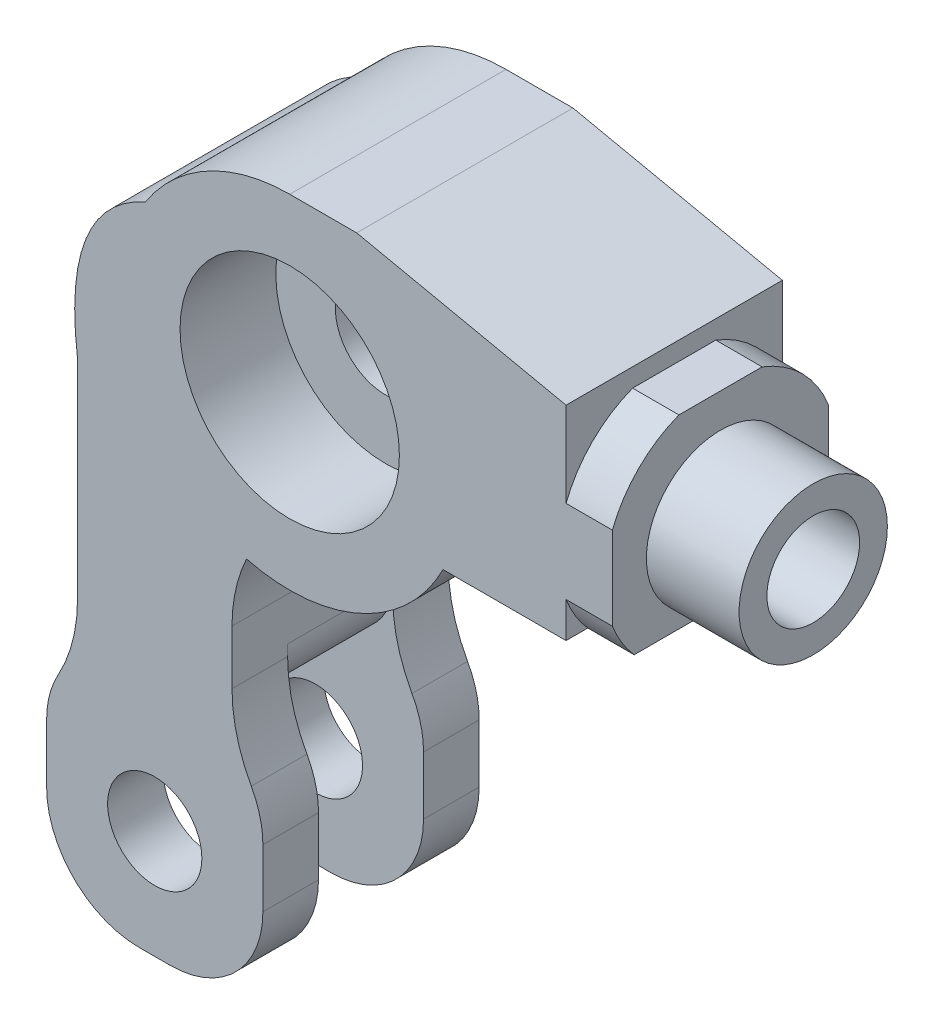
from build123d import *

# Parameters (mm, degrees)
SKETCH1_R           = 1.625
SKETCH1_R_2         = 1.525
BOSS_EXTRUDE1_DEPTH = 7
SKETCH2_R           = 1.5
CUT_EXTRUDE1_DEPTH  = 3
SKETCH3_W           = 10.588435917
SKETCH3_H           = 3.4
CUT_EXTRUDE2_DEPTH  = 6.11
FILLET1_R           = 5
BOSS_EXTRUDE2_DEPTH = 7
BOSS_EXTRUDE3_DEPTH = 1.8
BOSS_EXTRUDE4_START = -7
BOSS_EXTRUDE4_DEPTH = 1.8
FILLET4_R           = 5
FILLET5_R           = 3
FILLET6_R           = 2
CUT_EXTRUDE3_START  = -3
SKETCH8_W           = 5.7
SKETCH8_H           = 8.259283933
CUT_EXTRUDE3_DEPTH  = 2.6
FILLET7_R           = 0.7
SKETCH9_R           = 5.326360015
SKETCH9_R_2         = 3.75
CUT_EXTRUDE5_DEPTH  = 2.5
SKETCH10_R          = 4.869989517
SKETCH10_R_2        = 2.4
CUT_EXTRUDE6_DEPTH  = 1
BOSS_EXTRUDE5_START = 2
SKETCH11_R          = 2.4
SKETCH11_R_2        = 1.5
BOSS_EXTRUDE5_DEPTH = 2
CUT_EXTRUDE7_START  = -7
SKETCH12_R          = 3.575
CUT_EXTRUDE7_DEPTH  = 3.1
CUT_EXTRUDE8_START  = -3.1
SKETCH14_R          = 3.575
CUT_EXTRUDE8_DEPTH  = 3.1
SKETCH15_R          = 5.55
SKETCH15_R_2        = 3.55
BOSS_EXTRUDE6_DEPTH = 7
SKETCH16_R          = 1.407083064
BOSS_EXTRUDE7_DEPTH = 1
SKETCH17_R          = 1.5
CUT_EXTRUDE9_DEPTH  = 2.2
BOSS_EXTRUDE8_DEPTH = 7
CUT_EXTRUDE10_START = -3.1
SKETCH19_R          = 3.55
CUT_EXTRUDE10_DEPTH = 3.1


with BuildPart() as part:
    # Sketch1 → Boss-Extrude1 (new body)
    with BuildSketch(Plane.XY):
        Polygon((2.722541385, 17.747241978), (-15.590111015, 17.747241978), (-15.590111015, -1.762758022), (-10.590111015, -1.762758022), (-10.590111015, 9.80448846), (-10.590111015, 12.747241978), (2.722541385, 12.747241978), align=None)
        with Locations((-8.721930535, 15.237241978)):
            Circle(SKETCH1_R, mode=Mode.SUBTRACT)
        with Locations((-13.090111015, 0.749566092)):
            Circle(SKETCH1_R_2, mode=Mode.SUBTRACT)
    extrude(amount=BOSS_EXTRUDE1_DEPTH)

    # Sketch2 → Cut-Extrude1 (cut)
    with BuildSketch(Plane(origin=(2.722541385, 0, 0), x_dir=(0, 0, -1), z_dir=(1, 0, 0))):
        with Locations(Location((-3.5, 15.247241978, 0), (0, 0, 90))):
            Circle(SKETCH2_R)
    extrude(amount=-CUT_EXTRUDE1_DEPTH, mode=Mode.SUBTRACT)

    # Sketch3 → Cut-Extrude2 (cut)
    with BuildSketch(Plane.XZ.offset(1.762758022)):
        with Locations((-13.988004801, 3.5)):
            Rectangle(SKETCH3_W, SKETCH3_H)
    extrude(amount=-CUT_EXTRUDE2_DEPTH, mode=Mode.SUBTRACT)

    # Fillet1
    fillet1_edges = [part.edges().sort_by_distance(p)[0] for p in [
        (-10.590111015, 12.747241978, 3.5),
        (-15.590111015, 17.747241978, 3.5),
    ]]
    fillet(fillet1_edges, radius=FILLET1_R)

    # Sketch5 → Boss-Extrude2 (add)
    with BuildSketch(Plane.XY.offset(7)):
        with BuildLine():
            Line((2.722541385, 17.747241978), (-10.590111015, 17.747241978))
            Line((-10.590111015, 17.747241978), (-15.590111015, 12.747241978))
            add(Edge.make_bspline(
                [(-10.590111015, 18.747241978), (-16.362035667, 18.743656789), (-15.590111015, 12.747241978)],
                knots=[0, 0, 0, 1, 1, 1], degree=2))
            Line((-10.590111015, 18.747241978), (2.722541385, 18.747241978))
            Line((2.722541385, 18.747241978), (2.722541385, 17.747241978))
        make_face()
    extrude(amount=-BOSS_EXTRUDE2_DEPTH)

    # Sketch7 → Boss-Extrude3 (add)
    with BuildSketch(Plane.XY.offset(7)):
        Polygon((-10.590111015, -1.762758022), (-10.590111015, 2.992241978), (-9.590111015, 2.992241978), (-9.590111015, -1.762758022), (-9.590111015, -2.762758022), (-16.590111015, -2.762758022), (-16.590111015, -1.762758022), (-16.590111015, 2.992241978), (-15.590111015, 2.992241978), (-15.590111015, -1.762758022), align=None)
    extrude(amount=-BOSS_EXTRUDE3_DEPTH)

    # Sketch7<2> → Boss-Extrude4 (add)
    with BuildSketch(Plane.XY.offset(7).offset(BOSS_EXTRUDE4_START)):
        Polygon((-10.590111015, -1.762758022), (-10.590111015, 2.992241978), (-9.590111015, 2.992241978), (-9.590111015, -1.762758022), (-9.590111015, -2.762758022), (-16.590111015, -2.762758022), (-16.590111015, -1.762758022), (-16.590111015, 2.992241978), (-15.590111015, 2.992241978), (-15.590111015, -1.762758022), align=None)
    extrude(amount=BOSS_EXTRUDE4_DEPTH)

    # Fillet4
    # the kernel refuses this fillet: 5 mm, written as the material it adds along each edge
    with BuildSketch(Plane(origin=(-15.590111015, 2.992241978, 0), x_dir=(0, 1, 0), z_dir=(0, 0, 1))) as fillet4_piece_1_section:
        with BuildLine():
            CenterArc((3, 5), FILLET4_R, 233.130102354, 36.869897646)
            Line((0, 1), (-0.06, 0.92))
            ThreePointArc((-0.06, 0.92), (-0.1, 0.5), (-0.1, 0))
            Line((-0.1, 0), (0, -0.1))
            Line((0, -0.1), (3, -0.1))
            Line((3, -0.1), (3, 0))
        make_face()
    fillet4_piece_1 = extrude(amount=1.8, mode=Mode.PRIVATE)
    fillet4_piece_1 = split(fillet4_piece_1, bisect_by=Plane(origin=(-15.603784391, 4.347241978, 0.9), z_dir=(0, 1, 0)), keep=Keep.TOP, mode=Mode.PRIVATE)
    add(fillet4_piece_1)
    with BuildSketch(Plane(origin=(-15.590111015, 2.992241978, 0), x_dir=(0, 1, 0), z_dir=(0, 0, 1))) as fillet4_piece_2_section:
        with BuildLine():
            CenterArc((3, 5), FILLET4_R, 233.130102354, 36.869897646)
            Line((0, 1), (-0.06, 0.92))
            ThreePointArc((-0.06, 0.92), (-0.1, 0.5), (-0.1, 0))
            Line((-0.1, 0), (0, -0.1))
            Line((0, -0.1), (3, -0.1))
            Line((3, -0.1), (3, 0))
        make_face()
    fillet4_piece_2 = extrude(amount=1.8, mode=Mode.PRIVATE)
    fillet4_piece_2 = split(fillet4_piece_2, bisect_by=Plane(origin=(-15.881039753, 4.347241978, 0.9), z_dir=(0, -1, 0)), keep=Keep.TOP, mode=Mode.PRIVATE)
    add(fillet4_piece_2)
    with BuildSketch(Plane(origin=(-15.590111015, 2.992241978, 0), x_dir=(0, 1, 0), z_dir=(0, 0, 1))) as fillet4_piece_3_section:
        with BuildLine():
            CenterArc((3, 5), FILLET4_R, 233.130102354, 36.869897646)
            Line((0, 1), (-0.06, 0.92))
            ThreePointArc((-0.06, 0.92), (-0.1, 0.5), (-0.1, 0))
            Line((-0.1, 0), (0, -0.1))
            Line((0, -0.1), (3, -0.1))
            Line((3, -0.1), (3, 0))
        make_face()
    fillet4_piece_3 = extrude(amount=9.3, mode=Mode.PRIVATE)
    fillet4_piece_3 = split(fillet4_piece_3, bisect_by=Plane(origin=(-15.603784391, 4.971879793, 1.8), z_dir=(0, 0, 1)), keep=Keep.TOP, mode=Mode.PRIVATE)
    fillet4_piece_3 = split(fillet4_piece_3, bisect_by=Plane(origin=(-15.603784391, 4.347241978, 3.5), z_dir=(0, 1, 0)), keep=Keep.TOP, mode=Mode.PRIVATE)
    fillet4_piece_3 = split(fillet4_piece_3, bisect_by=Plane(origin=(-15.603784391, 4.971879793, 5.2), z_dir=(0, 0, -1)), keep=Keep.TOP, mode=Mode.PRIVATE)
    add(fillet4_piece_3)
    with BuildSketch(Plane(origin=(-15.590111015, 2.992241978, 0), x_dir=(0, 1, 0), z_dir=(0, 0, 1))) as fillet4_piece_4_section:
        with BuildLine():
            CenterArc((3, 5), FILLET4_R, 233.130102354, 36.869897646)
            Line((0, 1), (-0.06, 0.92))
            ThreePointArc((-0.06, 0.92), (-0.1, 0.5), (-0.1, 0))
            Line((-0.1, 0), (0, -0.1))
            Line((0, -0.1), (3, -0.1))
            Line((3, -0.1), (3, 0))
        make_face()
    fillet4_piece_4 = extrude(amount=9.3, mode=Mode.PRIVATE)
    fillet4_piece_4 = split(fillet4_piece_4, bisect_by=Plane(origin=(-15.603784391, 4.347241978, 6.1), z_dir=(0, 1, 0)), keep=Keep.TOP, mode=Mode.PRIVATE)
    fillet4_piece_4 = split(fillet4_piece_4, bisect_by=Plane(origin=(-15.603784391, 4.971879793, 5.2), z_dir=(0, 0, 1)), keep=Keep.TOP, mode=Mode.PRIVATE)
    fillet4_piece_4 = split(fillet4_piece_4, bisect_by=Plane(origin=(-15.603784391, 4.971879793, 7), z_dir=(0, 0, -1)), keep=Keep.TOP, mode=Mode.PRIVATE)
    add(fillet4_piece_4)
    with BuildSketch(Plane(origin=(-15.590111015, 2.992241978, 0), x_dir=(0, 1, 0), z_dir=(0, 0, 1))) as fillet4_piece_5_section:
        with BuildLine():
            CenterArc((3, 5), FILLET4_R, 233.130102354, 36.869897646)
            Line((0, 1), (-0.06, 0.92))
            ThreePointArc((-0.06, 0.92), (-0.1, 0.5), (-0.1, 0))
            Line((-0.1, 0), (0, -0.1))
            Line((0, -0.1), (3, -0.1))
            Line((3, -0.1), (3, 0))
        make_face()
    fillet4_piece_5 = extrude(amount=9.3, mode=Mode.PRIVATE)
    fillet4_piece_5 = split(fillet4_piece_5, bisect_by=Plane(origin=(-15.881039753, 4.347241978, 6.1), z_dir=(0, -1, 0)), keep=Keep.TOP, mode=Mode.PRIVATE)
    fillet4_piece_5 = split(fillet4_piece_5, bisect_by=Plane(origin=(-15.881039753, 3.497683508, 5.2), z_dir=(0, 0, 1)), keep=Keep.TOP, mode=Mode.PRIVATE)
    fillet4_piece_5 = split(fillet4_piece_5, bisect_by=Plane(origin=(-15.881039753, 3.497683508, 7), z_dir=(0, 0, -1)), keep=Keep.TOP, mode=Mode.PRIVATE)
    add(fillet4_piece_5)
    with BuildSketch(Plane(origin=(-10.590111015, 2.992241978, 0), x_dir=(0, 1, 0), z_dir=(0, 0, 1))) as fillet4_piece_6_section:
        with BuildLine():
            CenterArc((3, -5), FILLET4_R, 90, 36.869897646)
            Line((0, -1), (-0.06, -0.92))
            ThreePointArc((-0.06, -0.92), (-0.1, -0.5), (-0.1, 0))
            Line((-0.1, 0), (0, 0.1))
            Line((0, 0.1), (3, 0.1))
            Line((3, 0.1), (3, 0))
        make_face()
    fillet4_piece_6 = extrude(amount=1.8, mode=Mode.PRIVATE)
    fillet4_piece_6 = split(fillet4_piece_6, bisect_by=Plane(origin=(-10.576437639, 4.347241978, 0.9), z_dir=(0, 1, 0)), keep=Keep.TOP, mode=Mode.PRIVATE)
    add(fillet4_piece_6)
    with BuildSketch(Plane(origin=(-10.590111015, 2.992241978, 0), x_dir=(0, 1, 0), z_dir=(0, 0, 1))) as fillet4_piece_7_section:
        with BuildLine():
            CenterArc((3, -5), FILLET4_R, 90, 36.869897646)
            Line((0, -1), (-0.06, -0.92))
            ThreePointArc((-0.06, -0.92), (-0.1, -0.5), (-0.1, 0))
            Line((-0.1, 0), (0, 0.1))
            Line((0, 0.1), (3, 0.1))
            Line((3, 0.1), (3, 0))
        make_face()
    fillet4_piece_7 = extrude(amount=1.8, mode=Mode.PRIVATE)
    fillet4_piece_7 = split(fillet4_piece_7, bisect_by=Plane(origin=(-10.299182277, 4.347241978, 0.9), z_dir=(0, -1, 0)), keep=Keep.TOP, mode=Mode.PRIVATE)
    add(fillet4_piece_7)
    with BuildSketch(Plane(origin=(-10.590111015, 2.992241978, 0), x_dir=(0, 1, 0), z_dir=(0, 0, 1))) as fillet4_piece_8_section:
        with BuildLine():
            CenterArc((3, -5), FILLET4_R, 90, 36.869897646)
            Line((0, -1), (-0.06, -0.92))
            ThreePointArc((-0.06, -0.92), (-0.1, -0.5), (-0.1, 0))
            Line((-0.1, 0), (0, 0.1))
            Line((0, 0.1), (3, 0.1))
            Line((3, 0.1), (3, 0))
        make_face()
    fillet4_piece_8 = extrude(amount=9.3, mode=Mode.PRIVATE)
    fillet4_piece_8 = split(fillet4_piece_8, bisect_by=Plane(origin=(-10.576437639, 4.971879793, 5.2), z_dir=(0, 0, -1)), keep=Keep.TOP, mode=Mode.PRIVATE)
    fillet4_piece_8 = split(fillet4_piece_8, bisect_by=Plane(origin=(-10.576437639, 4.347241978, 3.5), z_dir=(0, 1, 0)), keep=Keep.TOP, mode=Mode.PRIVATE)
    fillet4_piece_8 = split(fillet4_piece_8, bisect_by=Plane(origin=(-10.576437639, 4.971879793, 1.8), z_dir=(0, 0, 1)), keep=Keep.TOP, mode=Mode.PRIVATE)
    add(fillet4_piece_8)
    with BuildSketch(Plane(origin=(-10.590111015, 2.992241978, 0), x_dir=(0, 1, 0), z_dir=(0, 0, 1))) as fillet4_piece_9_section:
        with BuildLine():
            CenterArc((3, -5), FILLET4_R, 90, 36.869897646)
            Line((0, -1), (-0.06, -0.92))
            ThreePointArc((-0.06, -0.92), (-0.1, -0.5), (-0.1, 0))
            Line((-0.1, 0), (0, 0.1))
            Line((0, 0.1), (3, 0.1))
            Line((3, 0.1), (3, 0))
        make_face()
    fillet4_piece_9 = extrude(amount=9.3, mode=Mode.PRIVATE)
    fillet4_piece_9 = split(fillet4_piece_9, bisect_by=Plane(origin=(-10.576437639, 4.971879793, 7), z_dir=(0, 0, -1)), keep=Keep.TOP, mode=Mode.PRIVATE)
    fillet4_piece_9 = split(fillet4_piece_9, bisect_by=Plane(origin=(-10.576437639, 4.971879793, 5.2), z_dir=(0, 0, 1)), keep=Keep.TOP, mode=Mode.PRIVATE)
    fillet4_piece_9 = split(fillet4_piece_9, bisect_by=Plane(origin=(-10.576437639, 4.347241978, 6.1), z_dir=(0, 1, 0)), keep=Keep.TOP, mode=Mode.PRIVATE)
    add(fillet4_piece_9)
    with BuildSketch(Plane(origin=(-10.590111015, 2.992241978, 0), x_dir=(0, 1, 0), z_dir=(0, 0, 1))) as fillet4_piece_10_section:
        with BuildLine():
            CenterArc((3, -5), FILLET4_R, 90, 36.869897646)
            Line((0, -1), (-0.06, -0.92))
            ThreePointArc((-0.06, -0.92), (-0.1, -0.5), (-0.1, 0))
            Line((-0.1, 0), (0, 0.1))
            Line((0, 0.1), (3, 0.1))
            Line((3, 0.1), (3, 0))
        make_face()
    fillet4_piece_10 = extrude(amount=9.3, mode=Mode.PRIVATE)
    fillet4_piece_10 = split(fillet4_piece_10, bisect_by=Plane(origin=(-10.299182277, 3.497683508, 7), z_dir=(0, 0, -1)), keep=Keep.TOP, mode=Mode.PRIVATE)
    fillet4_piece_10 = split(fillet4_piece_10, bisect_by=Plane(origin=(-10.299182277, 3.497683508, 5.2), z_dir=(0, 0, 1)), keep=Keep.TOP, mode=Mode.PRIVATE)
    fillet4_piece_10 = split(fillet4_piece_10, bisect_by=Plane(origin=(-10.299182277, 4.347241978, 6.1), z_dir=(0, -1, 0)), keep=Keep.TOP, mode=Mode.PRIVATE)
    add(fillet4_piece_10)

    # Fillet5
    fillet5_edges = [part.edges().sort_by_distance(p)[0] for p in [
        (-9.590111015, 2.992241978, 6.1),
        (-9.590111015, -2.762758022, 6.1),
        (-16.590111015, -2.762758022, 6.1),
        (-16.590111015, 2.992241978, 6.1),
        (-9.590111015, 2.992241978, 0.9),
        (-9.590111015, -2.762758022, 0.9),
        (-16.590111015, -2.762758022, 0.9),
        (-16.590111015, 2.992241978, 0.9),
    ]]
    fillet(fillet5_edges, radius=FILLET5_R)

    # Fillet6
    # the kernel refuses this fillet: 2 mm, written as the material it takes off along each edge
    with BuildSketch(Plane(origin=(-15.868461409, 4.347241978, 1.8), x_dir=(1, 0, 0), z_dir=(0, 0, 1))) as fillet6_piece_1:
        with BuildLine():
            CenterArc((2.278350394, 2), FILLET6_R, 180, 90)
            Line((0.278350394, 2), (0.078350394, 2))
            ThreePointArc((0.078350394, 2), (0.078350394, 1.645), (-0.188865984, 0.0658))
            Line((-0.188865984, 0.0658), (0, -0.2))
            Line((0, -0.2), (2.278350394, -0.2))
            Line((2.278350394, -0.2), (2.278350394, 0))
        make_face()
    extrude(amount=3.4, mode=Mode.SUBTRACT)
    with BuildSketch(Plane(origin=(-10.311760621, 4.347241978, 5.2), x_dir=(-0.13784657416957666, 0.9904535940616861, 0), z_dir=(0, 0, -1))) as fillet6_piece_2:
        with BuildLine():
            CenterArc((2.294969985, -1.980907188), FILLET6_R, 97.923255875, 90)
            Line((0.314062797, -2.256600336), (0.115972078, -2.284169651))
            Line((0.115972078, -2.284169651), (-0.198090719, -0.027569315))
            Line((-0.198090719, -0.027569315), (0.039137318, 0.196133297))
            ThreePointArc((0.039137318, 0.196133297), (1.640096496, 0.149155185), (1.991707522, 0.198090719))
            Line((1.991707522, 0.198090719), (2.019276836, 0))
        make_face()
    extrude(amount=3.4, mode=Mode.SUBTRACT)

    # Sketch8 → Cut-Extrude3 (cut)
    with BuildSketch(Plane(origin=(2.722541385, 0, 0), x_dir=(0, 0, -1), z_dir=(1, 0, 0)).offset(CUT_EXTRUDE3_START)):
        with Locations((-3.5, 15.247241978)):
            Rectangle(SKETCH8_W, SKETCH8_H)
    extrude(amount=-CUT_EXTRUDE3_DEPTH, mode=Mode.SUBTRACT)

    # Fillet7
    # the kernel refuses this fillet: 0.7 mm, written as the material it takes off along each edge
    with BuildSketch(Plane(origin=(-0.277458615, 12.747241978, 0.65), x_dir=(0, 0, -1), z_dir=(-1, 0, 0)), Plane(origin=(-2.877458615, 12.747241978, 6.35), x_dir=(0, 0, 1), z_dir=(1, 0, 0))) as fillet7_piece_1:
        with BuildLine():
            CenterArc((FILLET7_R, -FILLET7_R), FILLET7_R, 90, 90)
            Line((0, -FILLET7_R), (0, 0))
            Line((0, 0), (FILLET7_R, 0))
        make_face()
    extrude(amount=2.6, mode=Mode.SUBTRACT)

    # Sketch9 → Cut-Extrude5 (cut)
    with BuildSketch(Plane(origin=(2.722541385, 0, 0), x_dir=(0, 0, -1), z_dir=(1, 0, 0))):
        with Locations((-3.5, 15.247241978)):
            Circle(SKETCH9_R)
        with Locations((-3.5, 15.247241978)):
            Circle(SKETCH9_R_2, mode=Mode.SUBTRACT)
    extrude(amount=-CUT_EXTRUDE5_DEPTH, mode=Mode.SUBTRACT)

    # Sketch10 → Cut-Extrude6 (cut)
    with BuildSketch(Plane(origin=(2.722541385, 0, 0), x_dir=(0, 0, -1), z_dir=(1, 0, 0))):
        with Locations((-3.5, 15.247241978)):
            Circle(SKETCH10_R)
        with Locations((-3.5, 15.247241978)):
            Circle(SKETCH10_R_2, mode=Mode.SUBTRACT)
    extrude(amount=-CUT_EXTRUDE6_DEPTH, mode=Mode.SUBTRACT)

    # Sketch11 → Boss-Extrude5 (add)
    with BuildSketch(Plane(origin=(2.722541385, 0, 0), x_dir=(0, 0, -1), z_dir=(1, 0, 0)).offset(BOSS_EXTRUDE5_START)):
        with Locations((-3.5, 15.247241978)):
            Circle(SKETCH11_R)
        with Locations(Location((-3.5, 15.247241978, 0), (0, 0, 90))):
            Circle(SKETCH11_R_2, mode=Mode.SUBTRACT)
    extrude(amount=-BOSS_EXTRUDE5_DEPTH)

    # Sketch12 → Cut-Extrude7 (cut)
    with BuildSketch(Plane.XY.offset(7).offset(CUT_EXTRUDE7_START)):
        with Locations((-8.721930535, 15.237241978)):
            Circle(SKETCH12_R)
    extrude(amount=CUT_EXTRUDE7_DEPTH, mode=Mode.SUBTRACT)

    # Sketch14 → Cut-Extrude8 (cut)
    with BuildSketch(Plane.XY.offset(7).offset(CUT_EXTRUDE8_START)):
        with Locations((-8.721930535, 15.237241978)):
            Circle(SKETCH14_R)
    extrude(amount=CUT_EXTRUDE8_DEPTH, mode=Mode.SUBTRACT)

    # Sketch15 → Boss-Extrude6 (add)
    with BuildSketch(Plane.XY.offset(7)):
        with Locations((-8.721930535, 15.237241978)):
            Circle(SKETCH15_R)
        with Locations((-8.721930535, 15.237241978)):
            Circle(SKETCH15_R_2, mode=Mode.SUBTRACT)
    extrude(amount=-BOSS_EXTRUDE6_DEPTH)

    # Sketch16 → Boss-Extrude7 (add)
    with BuildSketch(Plane.XY.offset(3.9)):
        with Locations((-7.473849804, 12.118973855)):
            Circle(SKETCH16_R)
    extrude(amount=-BOSS_EXTRUDE7_DEPTH)

    # Sketch17 → Cut-Extrude9 (cut)
    with BuildSketch(Plane(origin=(-2.877458615, 0, 0), x_dir=(0, 0, -1), z_dir=(1, 0, 0))):
        with Locations(Location((-3.5, 15.247241978, 0), (0, 0, 90))):
            Circle(SKETCH17_R)
    extrude(amount=-CUT_EXTRUDE9_DEPTH, mode=Mode.SUBTRACT)

    # Sketch18 → Boss-Extrude8 (add)
    with BuildSketch(Plane.XY.offset(7)):
        Polygon((-4.697631712, 18.747241978), (0.222541385, 18.747241978), (0.222541385, 19.347241978), (-6.555314255, 20.787241978), (-8.721930535, 20.787241978), align=None)
    extrude(amount=-BOSS_EXTRUDE8_DEPTH)

    # Sketch19 → Cut-Extrude10 (cut)
    with BuildSketch(Plane(origin=(0, 0, 0), x_dir=(-1, 0, 0), z_dir=(0, 0, -1)).offset(CUT_EXTRUDE10_START)):
        with Locations(Location((8.721930535, 15.237241978, 0), (0, 0, 180))):
            Circle(SKETCH19_R)
    extrude(amount=CUT_EXTRUDE10_DEPTH, mode=Mode.SUBTRACT)


solid = part.part
